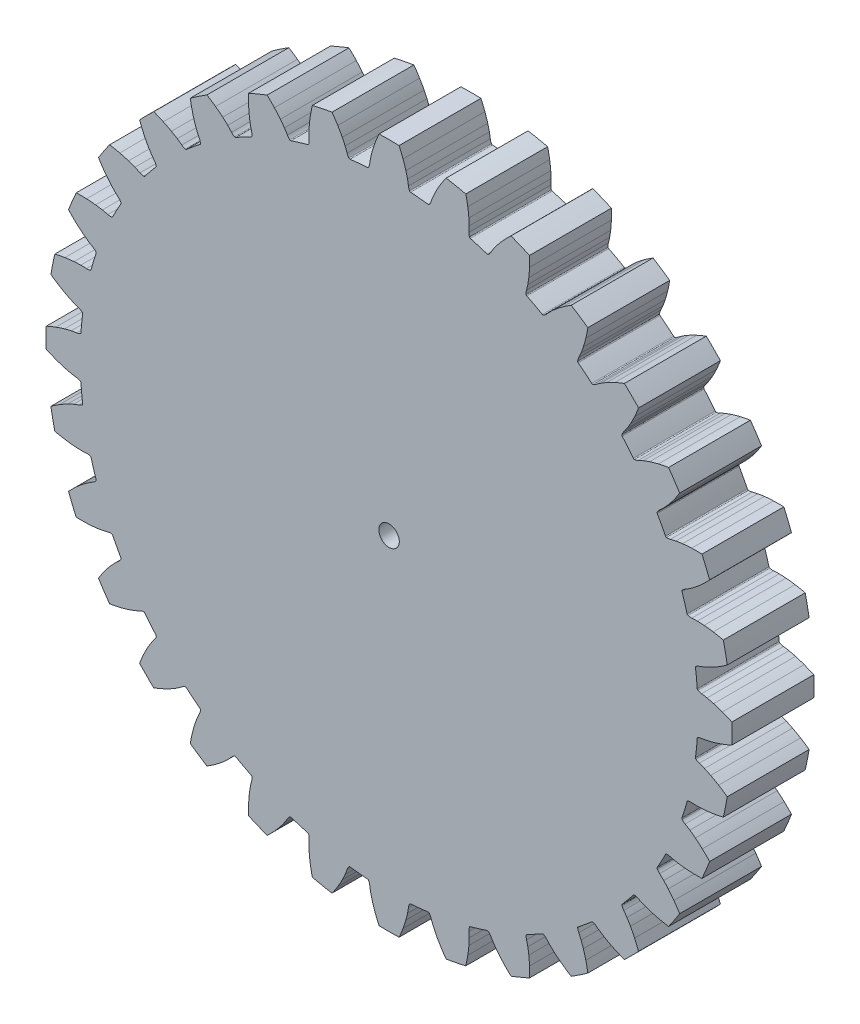
from build123d import *

# Parameters (mm, degrees)
BOSS_EXTRUDE1_DEPTH = 12.7
SKETCH2_R           = 1.5875
CUT_EXTRUDE1_DEPTH  = 77.306549185


with BuildPart() as part:
    # Model → Boss-Extrude1 (new body)
    with BuildSketch(Plane.XY):
        with BuildLine():
            ThreePointArc((47.688684308, -4.696925442), (47.750668499, -4.0181311), (47.802991315, -3.338523772))
            ThreePointArc((47.802991315, -3.338523772), (47.836540789, -3.240219855), (47.914385854, -3.171449418))
            ThreePointArc((47.914385854, -3.171449418), (48.187811806, -3.062492558), (48.475756522, -3.001491007))
            ThreePointArc((48.475756522, -3.001491007), (48.904401032, -2.939153054), (49.330070734, -2.858981734))
            ThreePointArc((49.330070734, -2.858981734), (49.842301009, -2.742156063), (50.350208962, -2.60777748))
            ThreePointArc((50.350208962, -2.60777748), (51.029288231, -2.400648092), (51.699447533, -2.166260071))
            ThreePointArc((51.699447533, -2.166260071), (52.446034926, -1.872790357), (53.181655372, -1.552821976))
            ThreePointArc((53.181655372, -1.552821976), (53.204320541, 0), (53.181655372, 1.552821976))
            ThreePointArc((53.181655372, 1.552821976), (52.446034933, 1.872790354), (51.699447549, 2.166260065))
            ThreePointArc((51.699447549, 2.166260065), (51.029288253, 2.400648085), (50.350208991, 2.607777472))
            ThreePointArc((50.350208991, 2.607777472), (49.84230104, 2.742156056), (49.330070766, 2.858981727))
            ThreePointArc((49.330070766, 2.858981727), (48.904401064, 2.939153049), (48.475756554, 3.001491003))
            ThreePointArc((48.475756554, 3.001491003), (48.187811841, 3.062492546), (47.914385887, 3.171449391))
            ThreePointArc((47.914385887, 3.171449391), (47.836540814, 3.24021982), (47.802991318, 3.338523731))
            ThreePointArc((47.802991318, 3.338523731), (47.68868431, 4.696925421), (47.535783919, 6.051525995))
            ThreePointArc((47.535783919, 6.051525995), (47.549510606, 6.154486207), (47.612443453, 6.237122059))
            ThreePointArc((47.612443453, 6.237122059), (47.859359173, 6.397328101), (48.1298703, 6.513332751))
            ThreePointArc((48.1298703, 6.513332751), (48.538116994, 6.658097293), (48.939966924, 6.819772183))
            ThreePointArc((48.939966924, 6.819772183), (49.419563281, 7.034284251), (49.891495964, 7.265168713))
            ThreePointArc((49.891495964, 7.265168713), (50.517117975, 7.600799961), (51.12867352, 7.961425877))
            ThreePointArc((51.12867352, 7.961425877), (51.803662344, 8.394908626), (52.462725316, 8.852241335))
            ThreePointArc((52.462725316, 8.852241335), (52.182014441, 10.379648027), (51.856844238, 11.898211209))
            ThreePointArc((51.856844238, 11.898211209), (51.072935805, 12.068519056), (50.283440788, 12.210697855))
            ThreePointArc((50.283440788, 12.210697855), (49.58043158, 12.309840583), (48.873991697, 12.380508245))
            ThreePointArc((48.873991697, 12.380508245), (48.349627093, 12.413216856), (47.824447623, 12.427866586))
            ThreePointArc((47.824447623, 12.427866586), (47.391316396, 12.423453399), (46.958746639, 12.400969151))
            ThreePointArc((46.958746639, 12.400969151), (46.664433891, 12.404623339), (46.375005314, 12.458143852))
            ThreePointArc((46.375005314, 12.458143852), (46.285239567, 12.510406057), (46.233156574, 12.600275903))
            ThreePointArc((46.233156574, 12.600275903), (45.856034921, 13.910276095), (45.441803005, 15.209019012))
            ThreePointArc((45.441803005, 15.209019012), (45.435179397, 15.312678816), (45.480781552, 15.406004433))
            ThreePointArc((45.480781552, 15.406004433), (45.691698208, 15.611303028), (45.934380154, 15.777852784))
            ThreePointArc((45.934380154, 15.777852784), (46.306540342, 15.999480695), (46.669127631, 16.236446079))
            ThreePointArc((46.669127631, 16.236446079), (47.09765945, 16.540400966), (47.515480755, 16.858918547))
            ThreePointArc((47.515480755, 16.858918547), (48.063603207, 17.310153534), (48.593053257, 17.783158692))
            ThreePointArc((48.593053257, 17.783158692), (49.170504071, 18.339995979), (49.727682147, 18.917117976))
            ThreePointArc((49.727682147, 18.917117976), (49.154382789, 20.360412001), (48.53920366, 21.786358858))
            ThreePointArc((48.53920366, 21.786358858), (47.737132396, 21.800461339), (46.935069596, 21.785885375))
            ThreePointArc((46.935069596, 21.785885375), (46.226226726, 21.74597281), (45.51957431, 21.677463029))
            ThreePointArc((45.51957431, 21.677463029), (44.998904092, 21.607244694), (44.480957778, 21.519155501))
            ThreePointArc((44.480957778, 21.519155501), (44.057010016, 21.430327401), (43.637138424, 21.323885009))
            ThreePointArc((43.637138424, 21.323885009), (43.347767917, 21.270051415), (43.053459295, 21.266078831))
            ThreePointArc((43.053459295, 21.266078831), (42.955222521, 21.299824404), (42.886607551, 21.377806538))
            ThreePointArc((42.886607551, 21.377806538), (42.261163825, 22.589062659), (41.601519086, 23.782037958))
            ThreePointArc((41.601519086, 23.782037958), (41.574799724, 23.882413766), (41.601318722, 23.982842696))
            ThreePointArc((41.601318722, 23.982842696), (41.768130904, 24.225344334), (41.97365754, 24.436038783))
            ThreePointArc((41.97365754, 24.436038783), (42.295429313, 24.726013026), (42.604819936, 25.029162458))
            ThreePointArc((42.604819936, 25.029162458), (42.965818979, 25.410879347), (43.313472268, 25.804789596))
            ThreePointArc((43.313472268, 25.804789596), (43.763031121, 26.354287614), (44.190029209, 26.921494692))
            ThreePointArc((44.190029209, 26.921494692), (44.647750902, 27.580287572), (45.081632041, 28.255020382))
            ThreePointArc((45.081632041, 28.255020382), (44.237775773, 29.558736761), (43.356228707, 30.837268954))
            ThreePointArc((43.356228707, 30.837268954), (42.566817759, 30.694624119), (41.783010001, 30.523853538))
            ThreePointArc((41.783010001, 30.523853538), (41.095573903, 30.346419498), (40.415865211, 30.141365065))
            ThreePointArc((40.415865211, 30.141365065), (39.918898443, 29.970918235), (39.42808967, 29.783475339))
            ThreePointArc((39.42808967, 29.783475339), (39.029617448, 29.613645941), (38.638579452, 29.427335925))
            ThreePointArc((38.638579452, 29.427335925), (38.365271531, 29.318083343), (38.07739298, 29.256770328))
            ThreePointArc((38.07739298, 29.256770328), (37.974460363, 29.270702445), (37.891950251, 29.333800058))
            ThreePointArc((37.891950251, 29.333800058), (37.042219904, 30.399764214), (36.162512118, 31.441126522))
            ThreePointArc((36.162512118, 31.441126522), (36.116723813, 31.534360948), (36.123140543, 31.638033764))
            ThreePointArc((36.123140543, 31.638033764), (36.239437753, 31.908419244), (36.399910804, 32.155161515))
            ThreePointArc((36.399910804, 32.155161515), (36.658928655, 32.502338544), (36.903232904, 32.860022161))
            ThreePointArc((36.903232904, 32.860022161), (37.182826181, 33.304831886), (37.446951331, 33.758997052))
            ThreePointArc((37.446951331, 33.758997052), (37.780670292, 34.385641202), (38.08880712, 35.025252749))
            ThreePointArc((38.08880712, 35.025252749), (38.409209704, 35.760684181), (38.703120097, 36.5070982))
            ThreePointArc((38.703120097, 36.5070982), (37.621135843, 37.621135843), (36.5070982, 38.703120097))
            ThreePointArc((36.5070982, 38.703120097), (35.760684189, 38.409209707), (35.025252764, 38.088807127))
            ThreePointArc((35.025252764, 38.088807127), (34.385641222, 37.780670303), (33.758997077, 37.446951346))
            ThreePointArc((33.758997077, 37.446951346), (33.304831913, 37.182826197), (32.860022188, 36.903232922))
            ThreePointArc((32.860022188, 36.903232922), (32.50233857, 36.658928674), (32.155161541, 36.399910824))
            ThreePointArc((32.155161541, 36.399910824), (31.908419277, 36.239437769), (31.638033806, 36.123140547))
            ThreePointArc((31.638033806, 36.123140547), (31.53436099, 36.116723805), (31.441126553, 36.162512091))
            ThreePointArc((31.441126553, 36.162512091), (30.399764246, 37.042219878), (29.33380009, 37.891950226))
            ThreePointArc((29.33380009, 37.891950226), (29.27070246, 37.974460324), (29.256770332, 38.077392938))
            ThreePointArc((29.256770332, 38.077392938), (29.318083333, 38.365271496), (29.427335911, 38.638579423))
            ThreePointArc((29.427335911, 38.638579423), (29.613645927, 39.029617418), (29.783475326, 39.42808964))
            ThreePointArc((29.783475326, 39.42808964), (29.970918225, 39.918898413), (30.141365056, 40.415865183))
            ThreePointArc((30.141365056, 40.415865183), (30.346419492, 41.095573881), (30.523853534, 41.783009985))
            ThreePointArc((30.523853534, 41.783009985), (30.694624117, 42.566817751), (30.837268954, 43.356228707))
            ThreePointArc((30.837268954, 43.356228707), (29.558736761, 44.237775773), (28.255020382, 45.081632041))
            ThreePointArc((28.255020382, 45.081632041), (27.580287579, 44.647750906), (26.921494706, 44.190029219))
            ThreePointArc((26.921494706, 44.190029219), (26.354287633, 43.763031136), (25.804789618, 43.313472287))
            ThreePointArc((25.804789618, 43.313472287), (25.41087937, 42.965819), (25.029162482, 42.604819959))
            ThreePointArc((25.029162482, 42.604819959), (24.726013049, 42.295429337), (24.436038804, 41.973657564))
            ThreePointArc((24.436038804, 41.973657564), (24.225344363, 41.768130926), (23.982842736, 41.601318734))
            ThreePointArc((23.982842736, 41.601318734), (23.882413809, 41.574799725), (23.782037994, 41.601519065))
            ThreePointArc((23.782037994, 41.601519065), (22.589062696, 42.261163806), (21.377806575, 42.886607533))
            ThreePointArc((21.377806575, 42.886607533), (21.299824427, 42.955222485), (21.266078844, 43.053459254))
            ThreePointArc((21.266078844, 43.053459254), (21.270051412, 43.34776788), (21.323885001, 43.637138393))
            ThreePointArc((21.323885001, 43.637138393), (21.430327394, 44.057009984), (21.519155495, 44.480957745))
            ThreePointArc((21.519155495, 44.480957745), (21.607244689, 44.998904061), (21.677463025, 45.519574281))
            ThreePointArc((21.677463025, 45.519574281), (21.745972809, 46.226226703), (21.785885375, 46.935069579))
            ThreePointArc((21.785885375, 46.935069579), (21.800461339, 47.737132387), (21.786358858, 48.53920366))
            ThreePointArc((21.786358858, 48.53920366), (20.360412001, 49.154382789), (18.917117976, 49.727682147))
            ThreePointArc((18.917117976, 49.727682147), (18.339995985, 49.170504077), (17.783158704, 48.59305327))
            ThreePointArc((17.783158704, 48.59305327), (17.310153549, 48.063603224), (16.858918565, 47.515480778))
            ThreePointArc((16.858918565, 47.515480778), (16.540400984, 47.097659475), (16.236446098, 46.669127659))
            ThreePointArc((16.236446098, 46.669127659), (15.999480712, 46.30654037), (15.7778528, 45.934380183))
            ThreePointArc((15.7778528, 45.934380183), (15.611303052, 45.691698235), (15.40600447, 45.480781572))
            ThreePointArc((15.40600447, 45.480781572), (15.312678858, 45.435179406), (15.209019052, 45.441802992))
            ThreePointArc((15.209019052, 45.441802992), (13.910276134, 45.856034909), (12.600275943, 46.233156564))
            ThreePointArc((12.600275943, 46.233156564), (12.510406086, 46.285239536), (12.458143872, 46.375005277))
            ThreePointArc((12.458143872, 46.375005277), (12.404623344, 46.664433855), (12.400969149, 46.958746606))
            ThreePointArc((12.400969149, 46.958746606), (12.423453398, 47.391316363), (12.427866586, 47.82444759))
            ThreePointArc((12.427866586, 47.82444759), (12.413216857, 48.349627062), (12.380508247, 48.873991667))
            ThreePointArc((12.380508247, 48.873991667), (12.309840586, 49.580431557), (12.210697858, 50.283440771))
            ThreePointArc((12.210697858, 50.283440771), (12.068519058, 51.072935797), (11.898211209, 51.856844238))
            ThreePointArc((11.898211209, 51.856844238), (10.379648027, 52.182014441), (8.852241335, 52.462725316))
            ThreePointArc((8.852241335, 52.462725316), (8.394908631, 51.803662352), (7.961425885, 51.128673535))
            ThreePointArc((7.961425885, 51.128673535), (7.600799972, 50.517117996), (7.265168727, 49.89149599))
            ThreePointArc((7.265168727, 49.89149599), (7.034284264, 49.419563309), (6.819772196, 48.939966954))
            ThreePointArc((6.819772196, 48.939966954), (6.658097305, 48.538117025), (6.513332761, 48.129870331))
            ThreePointArc((6.513332761, 48.129870331), (6.397328119, 47.859359205), (6.237122092, 47.61244348))
            ThreePointArc((6.237122092, 47.61244348), (6.154486246, 47.549510624), (6.051526036, 47.535783914))
            ThreePointArc((6.051526036, 47.535783914), (4.696925462, 47.688684306), (3.338523772, 47.802991315))
            ThreePointArc((3.338523772, 47.802991315), (3.240219855, 47.836540789), (3.171449418, 47.914385854))
            ThreePointArc((3.171449418, 47.914385854), (3.062492558, 48.187811806), (3.001491007, 48.475756522))
            ThreePointArc((3.001491007, 48.475756522), (2.939153054, 48.904401032), (2.858981734, 49.330070734))
            ThreePointArc((2.858981734, 49.330070734), (2.742156063, 49.842301009), (2.60777748, 50.350208962))
            ThreePointArc((2.60777748, 50.350208962), (2.400648092, 51.029288231), (2.166260071, 51.699447533))
            ThreePointArc((2.166260071, 51.699447533), (1.872790357, 52.446034926), (1.552821976, 53.181655372))
            ThreePointArc((1.552821976, 53.181655372), (0, 53.204320541), (-1.552821976, 53.181655372))
            ThreePointArc((-1.552821976, 53.181655372), (-1.872790354, 52.446034933), (-2.166260065, 51.699447549))
            ThreePointArc((-2.166260065, 51.699447549), (-2.400648085, 51.029288253), (-2.607777472, 50.350208991))
            ThreePointArc((-2.607777472, 50.350208991), (-2.742156056, 49.84230104), (-2.858981727, 49.330070766))
            ThreePointArc((-2.858981727, 49.330070766), (-2.939153049, 48.904401064), (-3.001491003, 48.475756554))
            ThreePointArc((-3.001491003, 48.475756554), (-3.062492546, 48.187811841), (-3.171449391, 47.914385887))
            ThreePointArc((-3.171449391, 47.914385887), (-3.24021982, 47.836540814), (-3.338523731, 47.802991318))
            ThreePointArc((-3.338523731, 47.802991318), (-4.696925421, 47.68868431), (-6.051525995, 47.535783919))
            ThreePointArc((-6.051525995, 47.535783919), (-6.154486207, 47.549510606), (-6.237122059, 47.612443453))
            ThreePointArc((-6.237122059, 47.612443453), (-6.397328101, 47.859359173), (-6.513332751, 48.1298703))
            ThreePointArc((-6.513332751, 48.1298703), (-6.658097293, 48.538116994), (-6.819772183, 48.939966924))
            ThreePointArc((-6.819772183, 48.939966924), (-7.034284251, 49.419563281), (-7.265168713, 49.891495964))
            ThreePointArc((-7.265168713, 49.891495964), (-7.600799961, 50.517117975), (-7.961425877, 51.12867352))
            ThreePointArc((-7.961425877, 51.12867352), (-8.394908626, 51.803662344), (-8.852241335, 52.462725316))
            ThreePointArc((-8.852241335, 52.462725316), (-10.379648027, 52.182014441), (-11.898211209, 51.856844238))
            ThreePointArc((-11.898211209, 51.856844238), (-12.068519056, 51.072935805), (-12.210697855, 50.283440788))
            ThreePointArc((-12.210697855, 50.283440788), (-12.309840583, 49.58043158), (-12.380508245, 48.873991697))
            ThreePointArc((-12.380508245, 48.873991697), (-12.413216856, 48.349627093), (-12.427866586, 47.824447623))
            ThreePointArc((-12.427866586, 47.824447623), (-12.423453399, 47.391316396), (-12.400969151, 46.958746639))
            ThreePointArc((-12.400969151, 46.958746639), (-12.404623339, 46.664433891), (-12.458143852, 46.375005314))
            ThreePointArc((-12.458143852, 46.375005314), (-12.510406057, 46.285239567), (-12.600275903, 46.233156574))
            ThreePointArc((-12.600275903, 46.233156574), (-13.910276095, 45.856034921), (-15.209019012, 45.441803005))
            ThreePointArc((-15.209019012, 45.441803005), (-15.312678816, 45.435179397), (-15.406004433, 45.480781552))
            ThreePointArc((-15.406004433, 45.480781552), (-15.611303028, 45.691698208), (-15.777852784, 45.934380154))
            ThreePointArc((-15.777852784, 45.934380154), (-15.999480695, 46.306540342), (-16.236446079, 46.669127631))
            ThreePointArc((-16.236446079, 46.669127631), (-16.540400966, 47.09765945), (-16.858918547, 47.515480755))
            ThreePointArc((-16.858918547, 47.515480755), (-17.310153534, 48.063603207), (-17.783158692, 48.593053257))
            ThreePointArc((-17.783158692, 48.593053257), (-18.339995979, 49.170504071), (-18.917117976, 49.727682147))
            ThreePointArc((-18.917117976, 49.727682147), (-20.360412001, 49.154382789), (-21.786358858, 48.53920366))
            ThreePointArc((-21.786358858, 48.53920366), (-21.800461339, 47.737132396), (-21.785885375, 46.935069596))
            ThreePointArc((-21.785885375, 46.935069596), (-21.74597281, 46.226226726), (-21.677463029, 45.51957431))
            ThreePointArc((-21.677463029, 45.51957431), (-21.607244694, 44.998904092), (-21.519155501, 44.480957778))
            ThreePointArc((-21.519155501, 44.480957778), (-21.430327401, 44.057010016), (-21.323885009, 43.637138424))
            ThreePointArc((-21.323885009, 43.637138424), (-21.270051415, 43.347767917), (-21.266078831, 43.053459295))
            ThreePointArc((-21.266078831, 43.053459295), (-21.299824404, 42.955222521), (-21.377806538, 42.886607551))
            ThreePointArc((-21.377806538, 42.886607551), (-22.589062659, 42.261163825), (-23.782037958, 41.601519086))
            ThreePointArc((-23.782037958, 41.601519086), (-23.882413766, 41.574799724), (-23.982842696, 41.601318722))
            ThreePointArc((-23.982842696, 41.601318722), (-24.225344334, 41.768130904), (-24.436038783, 41.97365754))
            ThreePointArc((-24.436038783, 41.97365754), (-24.726013026, 42.295429313), (-25.029162458, 42.604819936))
            ThreePointArc((-25.029162458, 42.604819936), (-25.410879347, 42.965818979), (-25.804789596, 43.313472268))
            ThreePointArc((-25.804789596, 43.313472268), (-26.354287614, 43.763031121), (-26.921494692, 44.190029209))
            ThreePointArc((-26.921494692, 44.190029209), (-27.580287572, 44.647750902), (-28.255020382, 45.081632041))
            ThreePointArc((-28.255020382, 45.081632041), (-29.558736761, 44.237775773), (-30.837268954, 43.356228707))
            ThreePointArc((-30.837268954, 43.356228707), (-30.694624119, 42.566817759), (-30.523853538, 41.783010001))
            ThreePointArc((-30.523853538, 41.783010001), (-30.346419498, 41.095573903), (-30.141365065, 40.415865211))
            ThreePointArc((-30.141365065, 40.415865211), (-29.970918235, 39.918898443), (-29.783475339, 39.42808967))
            ThreePointArc((-29.783475339, 39.42808967), (-29.613645941, 39.029617448), (-29.427335925, 38.638579452))
            ThreePointArc((-29.427335925, 38.638579452), (-29.318083343, 38.365271531), (-29.256770328, 38.07739298))
            ThreePointArc((-29.256770328, 38.07739298), (-29.270702445, 37.974460363), (-29.333800058, 37.891950251))
            ThreePointArc((-29.333800058, 37.891950251), (-30.399764214, 37.042219904), (-31.441126522, 36.162512118))
            ThreePointArc((-31.441126522, 36.162512118), (-31.534360948, 36.116723813), (-31.638033764, 36.123140543))
            ThreePointArc((-31.638033764, 36.123140543), (-31.908419244, 36.239437753), (-32.155161515, 36.399910804))
            ThreePointArc((-32.155161515, 36.399910804), (-32.502338544, 36.658928655), (-32.860022161, 36.903232904))
            ThreePointArc((-32.860022161, 36.903232904), (-33.304831886, 37.182826181), (-33.758997052, 37.446951331))
            ThreePointArc((-33.758997052, 37.446951331), (-34.385641202, 37.780670292), (-35.025252749, 38.08880712))
            ThreePointArc((-35.025252749, 38.08880712), (-35.760684181, 38.409209704), (-36.5070982, 38.703120097))
            ThreePointArc((-36.5070982, 38.703120097), (-37.621135843, 37.621135843), (-38.703120097, 36.5070982))
            ThreePointArc((-38.703120097, 36.5070982), (-38.409209707, 35.760684189), (-38.088807127, 35.025252764))
            ThreePointArc((-38.088807127, 35.025252764), (-37.780670303, 34.385641222), (-37.446951346, 33.758997077))
            ThreePointArc((-37.446951346, 33.758997077), (-37.182826197, 33.304831913), (-36.903232922, 32.860022188))
            ThreePointArc((-36.903232922, 32.860022188), (-36.658928674, 32.50233857), (-36.399910824, 32.155161541))
            ThreePointArc((-36.399910824, 32.155161541), (-36.239437769, 31.908419277), (-36.123140547, 31.638033806))
            ThreePointArc((-36.123140547, 31.638033806), (-36.116723805, 31.53436099), (-36.162512091, 31.441126553))
            ThreePointArc((-36.162512091, 31.441126553), (-37.042219878, 30.399764246), (-37.891950226, 29.33380009))
            ThreePointArc((-37.891950226, 29.33380009), (-37.974460324, 29.27070246), (-38.077392938, 29.256770332))
            ThreePointArc((-38.077392938, 29.256770332), (-38.365271496, 29.318083333), (-38.638579423, 29.427335911))
            ThreePointArc((-38.638579423, 29.427335911), (-39.029617418, 29.613645927), (-39.42808964, 29.783475326))
            ThreePointArc((-39.42808964, 29.783475326), (-39.918898413, 29.970918225), (-40.415865183, 30.141365056))
            ThreePointArc((-40.415865183, 30.141365056), (-41.095573881, 30.346419492), (-41.783009985, 30.523853534))
            ThreePointArc((-41.783009985, 30.523853534), (-42.566817751, 30.694624117), (-43.356228707, 30.837268954))
            ThreePointArc((-43.356228707, 30.837268954), (-44.237775773, 29.558736761), (-45.081632041, 28.255020382))
            ThreePointArc((-45.081632041, 28.255020382), (-44.647750906, 27.580287579), (-44.190029219, 26.921494706))
            ThreePointArc((-44.190029219, 26.921494706), (-43.763031136, 26.354287633), (-43.313472287, 25.804789618))
            ThreePointArc((-43.313472287, 25.804789618), (-42.965819, 25.41087937), (-42.604819959, 25.029162482))
            ThreePointArc((-42.604819959, 25.029162482), (-42.295429337, 24.726013049), (-41.973657564, 24.436038804))
            ThreePointArc((-41.973657564, 24.436038804), (-41.768130926, 24.225344363), (-41.601318734, 23.982842736))
            ThreePointArc((-41.601318734, 23.982842736), (-41.574799725, 23.882413809), (-41.601519065, 23.782037994))
            ThreePointArc((-41.601519065, 23.782037994), (-42.261163806, 22.589062696), (-42.886607533, 21.377806575))
            ThreePointArc((-42.886607533, 21.377806575), (-42.955222485, 21.299824427), (-43.053459254, 21.266078844))
            ThreePointArc((-43.053459254, 21.266078844), (-43.34776788, 21.270051412), (-43.637138393, 21.323885001))
            ThreePointArc((-43.637138393, 21.323885001), (-44.057009984, 21.430327394), (-44.480957745, 21.519155495))
            ThreePointArc((-44.480957745, 21.519155495), (-44.998904061, 21.607244689), (-45.519574281, 21.677463025))
            ThreePointArc((-45.519574281, 21.677463025), (-46.226226703, 21.745972809), (-46.935069579, 21.785885375))
            ThreePointArc((-46.935069579, 21.785885375), (-47.737132387, 21.800461339), (-48.53920366, 21.786358858))
            ThreePointArc((-48.53920366, 21.786358858), (-49.154382789, 20.360412001), (-49.727682147, 18.917117976))
            ThreePointArc((-49.727682147, 18.917117976), (-49.170504077, 18.339995985), (-48.59305327, 17.783158704))
            ThreePointArc((-48.59305327, 17.783158704), (-48.063603224, 17.310153549), (-47.515480778, 16.858918565))
            ThreePointArc((-47.515480778, 16.858918565), (-47.097659475, 16.540400984), (-46.669127659, 16.236446098))
            ThreePointArc((-46.669127659, 16.236446098), (-46.30654037, 15.999480712), (-45.934380183, 15.7778528))
            ThreePointArc((-45.934380183, 15.7778528), (-45.691698235, 15.611303052), (-45.480781572, 15.40600447))
            ThreePointArc((-45.480781572, 15.40600447), (-45.435179406, 15.312678858), (-45.441802992, 15.209019052))
            ThreePointArc((-45.441802992, 15.209019052), (-45.856034909, 13.910276134), (-46.233156564, 12.600275943))
            ThreePointArc((-46.233156564, 12.600275943), (-46.285239536, 12.510406086), (-46.375005277, 12.458143872))
            ThreePointArc((-46.375005277, 12.458143872), (-46.664433855, 12.404623344), (-46.958746606, 12.400969149))
            ThreePointArc((-46.958746606, 12.400969149), (-47.391316363, 12.423453398), (-47.82444759, 12.427866586))
            ThreePointArc((-47.82444759, 12.427866586), (-48.349627062, 12.413216857), (-48.873991667, 12.380508247))
            ThreePointArc((-48.873991667, 12.380508247), (-49.580431557, 12.309840586), (-50.283440771, 12.210697858))
            ThreePointArc((-50.283440771, 12.210697858), (-51.072935797, 12.068519058), (-51.856844238, 11.898211209))
            ThreePointArc((-51.856844238, 11.898211209), (-52.182014441, 10.379648027), (-52.462725316, 8.852241335))
            ThreePointArc((-52.462725316, 8.852241335), (-51.803662352, 8.394908631), (-51.128673535, 7.961425885))
            ThreePointArc((-51.128673535, 7.961425885), (-50.517117996, 7.600799972), (-49.89149599, 7.265168727))
            ThreePointArc((-49.89149599, 7.265168727), (-49.419563309, 7.034284264), (-48.939966954, 6.819772196))
            ThreePointArc((-48.939966954, 6.819772196), (-48.538117025, 6.658097305), (-48.129870331, 6.513332761))
            ThreePointArc((-48.129870331, 6.513332761), (-47.859359205, 6.397328119), (-47.61244348, 6.237122092))
            ThreePointArc((-47.61244348, 6.237122092), (-47.549510624, 6.154486246), (-47.535783914, 6.051526036))
            ThreePointArc((-47.535783914, 6.051526036), (-47.688684306, 4.696925462), (-47.802991315, 3.338523772))
            ThreePointArc((-47.802991315, 3.338523772), (-47.836540789, 3.240219855), (-47.914385854, 3.171449418))
            ThreePointArc((-47.914385854, 3.171449418), (-48.187811806, 3.062492558), (-48.475756522, 3.001491007))
            ThreePointArc((-48.475756522, 3.001491007), (-48.904401032, 2.939153054), (-49.330070734, 2.858981734))
            ThreePointArc((-49.330070734, 2.858981734), (-49.842301009, 2.742156063), (-50.350208962, 2.60777748))
            ThreePointArc((-50.350208962, 2.60777748), (-51.029288231, 2.400648092), (-51.699447533, 2.166260071))
            ThreePointArc((-51.699447533, 2.166260071), (-52.446034926, 1.872790357), (-53.181655372, 1.552821976))
            ThreePointArc((-53.181655372, 1.552821976), (-53.204320541, 0), (-53.181655372, -1.552821976))
            ThreePointArc((-53.181655372, -1.552821976), (-52.446034933, -1.872790354), (-51.699447549, -2.166260065))
            ThreePointArc((-51.699447549, -2.166260065), (-51.029288253, -2.400648085), (-50.350208991, -2.607777472))
            ThreePointArc((-50.350208991, -2.607777472), (-49.84230104, -2.742156056), (-49.330070766, -2.858981727))
            ThreePointArc((-49.330070766, -2.858981727), (-48.904401064, -2.939153049), (-48.475756554, -3.001491003))
            ThreePointArc((-48.475756554, -3.001491003), (-48.187811841, -3.062492546), (-47.914385887, -3.171449391))
            ThreePointArc((-47.914385887, -3.171449391), (-47.836540814, -3.24021982), (-47.802991318, -3.338523731))
            ThreePointArc((-47.802991318, -3.338523731), (-47.68868431, -4.696925421), (-47.535783919, -6.051525995))
            ThreePointArc((-47.535783919, -6.051525995), (-47.549510606, -6.154486207), (-47.612443453, -6.237122059))
            ThreePointArc((-47.612443453, -6.237122059), (-47.859359173, -6.397328101), (-48.1298703, -6.513332751))
            ThreePointArc((-48.1298703, -6.513332751), (-48.538116994, -6.658097293), (-48.939966924, -6.819772183))
            ThreePointArc((-48.939966924, -6.819772183), (-49.419563281, -7.034284251), (-49.891495964, -7.265168713))
            ThreePointArc((-49.891495964, -7.265168713), (-50.517117975, -7.600799961), (-51.12867352, -7.961425877))
            ThreePointArc((-51.12867352, -7.961425877), (-51.803662344, -8.394908626), (-52.462725316, -8.852241335))
            ThreePointArc((-52.462725316, -8.852241335), (-52.182014441, -10.379648027), (-51.856844238, -11.898211209))
            ThreePointArc((-51.856844238, -11.898211209), (-51.072935805, -12.068519056), (-50.283440788, -12.210697855))
            ThreePointArc((-50.283440788, -12.210697855), (-49.58043158, -12.309840583), (-48.873991697, -12.380508245))
            ThreePointArc((-48.873991697, -12.380508245), (-48.349627093, -12.413216856), (-47.824447623, -12.427866586))
            ThreePointArc((-47.824447623, -12.427866586), (-47.391316396, -12.423453399), (-46.958746639, -12.400969151))
            ThreePointArc((-46.958746639, -12.400969151), (-46.664433891, -12.404623339), (-46.375005314, -12.458143852))
            ThreePointArc((-46.375005314, -12.458143852), (-46.285239567, -12.510406057), (-46.233156574, -12.600275903))
            ThreePointArc((-46.233156574, -12.600275903), (-45.856034921, -13.910276095), (-45.441803005, -15.209019012))
            ThreePointArc((-45.441803005, -15.209019012), (-45.435179397, -15.312678816), (-45.480781552, -15.406004433))
            ThreePointArc((-45.480781552, -15.406004433), (-45.691698208, -15.611303028), (-45.934380154, -15.777852784))
            ThreePointArc((-45.934380154, -15.777852784), (-46.306540342, -15.999480695), (-46.669127631, -16.236446079))
            ThreePointArc((-46.669127631, -16.236446079), (-47.09765945, -16.540400966), (-47.515480755, -16.858918547))
            ThreePointArc((-47.515480755, -16.858918547), (-48.063603207, -17.310153534), (-48.593053257, -17.783158692))
            ThreePointArc((-48.593053257, -17.783158692), (-49.170504071, -18.339995979), (-49.727682147, -18.917117976))
            ThreePointArc((-49.727682147, -18.917117976), (-49.154382789, -20.360412001), (-48.53920366, -21.786358858))
            ThreePointArc((-48.53920366, -21.786358858), (-47.737132396, -21.800461339), (-46.935069596, -21.785885375))
            ThreePointArc((-46.935069596, -21.785885375), (-46.226226726, -21.74597281), (-45.51957431, -21.677463029))
            ThreePointArc((-45.51957431, -21.677463029), (-44.998904092, -21.607244694), (-44.480957778, -21.519155501))
            ThreePointArc((-44.480957778, -21.519155501), (-44.057010016, -21.430327401), (-43.637138424, -21.323885009))
            ThreePointArc((-43.637138424, -21.323885009), (-43.347767917, -21.270051415), (-43.053459295, -21.266078831))
            ThreePointArc((-43.053459295, -21.266078831), (-42.955222521, -21.299824404), (-42.886607551, -21.377806538))
            ThreePointArc((-42.886607551, -21.377806538), (-42.261163825, -22.589062659), (-41.601519086, -23.782037958))
            ThreePointArc((-41.601519086, -23.782037958), (-41.574799724, -23.882413766), (-41.601318722, -23.982842696))
            ThreePointArc((-41.601318722, -23.982842696), (-41.768130904, -24.225344334), (-41.97365754, -24.436038783))
            ThreePointArc((-41.97365754, -24.436038783), (-42.295429313, -24.726013026), (-42.604819936, -25.029162458))
            ThreePointArc((-42.604819936, -25.029162458), (-42.965818979, -25.410879347), (-43.313472268, -25.804789596))
            ThreePointArc((-43.313472268, -25.804789596), (-43.763031121, -26.354287614), (-44.190029209, -26.921494692))
            ThreePointArc((-44.190029209, -26.921494692), (-44.647750902, -27.580287572), (-45.081632041, -28.255020382))
            ThreePointArc((-45.081632041, -28.255020382), (-44.237775773, -29.558736761), (-43.356228707, -30.837268954))
            ThreePointArc((-43.356228707, -30.837268954), (-42.566817759, -30.694624119), (-41.783010001, -30.523853538))
            ThreePointArc((-41.783010001, -30.523853538), (-41.095573903, -30.346419498), (-40.415865211, -30.141365065))
            ThreePointArc((-40.415865211, -30.141365065), (-39.918898443, -29.970918235), (-39.42808967, -29.783475339))
            ThreePointArc((-39.42808967, -29.783475339), (-39.029617448, -29.613645941), (-38.638579452, -29.427335925))
            ThreePointArc((-38.638579452, -29.427335925), (-38.365271531, -29.318083343), (-38.07739298, -29.256770328))
            ThreePointArc((-38.07739298, -29.256770328), (-37.974460363, -29.270702445), (-37.891950251, -29.333800058))
            ThreePointArc((-37.891950251, -29.333800058), (-37.042219904, -30.399764214), (-36.162512118, -31.441126522))
            ThreePointArc((-36.162512118, -31.441126522), (-36.116723813, -31.534360948), (-36.123140543, -31.638033764))
            ThreePointArc((-36.123140543, -31.638033764), (-36.239437753, -31.908419244), (-36.399910804, -32.155161515))
            ThreePointArc((-36.399910804, -32.155161515), (-36.658928655, -32.502338544), (-36.903232904, -32.860022161))
            ThreePointArc((-36.903232904, -32.860022161), (-37.182826181, -33.304831886), (-37.446951331, -33.758997052))
            ThreePointArc((-37.446951331, -33.758997052), (-37.780670292, -34.385641202), (-38.08880712, -35.025252749))
            ThreePointArc((-38.08880712, -35.025252749), (-38.409209704, -35.760684181), (-38.703120097, -36.5070982))
            ThreePointArc((-38.703120097, -36.5070982), (-37.621135843, -37.621135843), (-36.5070982, -38.703120097))
            ThreePointArc((-36.5070982, -38.703120097), (-35.760684189, -38.409209707), (-35.025252764, -38.088807127))
            ThreePointArc((-35.025252764, -38.088807127), (-34.385641222, -37.780670303), (-33.758997077, -37.446951346))
            ThreePointArc((-33.758997077, -37.446951346), (-33.304831913, -37.182826197), (-32.860022188, -36.903232922))
            ThreePointArc((-32.860022188, -36.903232922), (-32.50233857, -36.658928674), (-32.155161541, -36.399910824))
            ThreePointArc((-32.155161541, -36.399910824), (-31.908419277, -36.239437769), (-31.638033806, -36.123140547))
            ThreePointArc((-31.638033806, -36.123140547), (-31.53436099, -36.116723805), (-31.441126553, -36.162512091))
            ThreePointArc((-31.441126553, -36.162512091), (-30.399764246, -37.042219878), (-29.33380009, -37.891950226))
            ThreePointArc((-29.33380009, -37.891950226), (-29.27070246, -37.974460324), (-29.256770332, -38.077392938))
            ThreePointArc((-29.256770332, -38.077392938), (-29.318083333, -38.365271496), (-29.427335911, -38.638579423))
            ThreePointArc((-29.427335911, -38.638579423), (-29.613645927, -39.029617418), (-29.783475326, -39.42808964))
            ThreePointArc((-29.783475326, -39.42808964), (-29.970918225, -39.918898413), (-30.141365056, -40.415865183))
            ThreePointArc((-30.141365056, -40.415865183), (-30.346419492, -41.095573881), (-30.523853534, -41.783009985))
            ThreePointArc((-30.523853534, -41.783009985), (-30.694624117, -42.566817751), (-30.837268954, -43.356228707))
            ThreePointArc((-30.837268954, -43.356228707), (-29.558736761, -44.237775773), (-28.255020382, -45.081632041))
            ThreePointArc((-28.255020382, -45.081632041), (-27.580287579, -44.647750906), (-26.921494706, -44.190029219))
            ThreePointArc((-26.921494706, -44.190029219), (-26.354287633, -43.763031136), (-25.804789618, -43.313472287))
            ThreePointArc((-25.804789618, -43.313472287), (-25.41087937, -42.965819), (-25.029162482, -42.604819959))
            ThreePointArc((-25.029162482, -42.604819959), (-24.726013049, -42.295429337), (-24.436038804, -41.973657564))
            ThreePointArc((-24.436038804, -41.973657564), (-24.225344363, -41.768130926), (-23.982842736, -41.601318734))
            ThreePointArc((-23.982842736, -41.601318734), (-23.882413809, -41.574799725), (-23.782037994, -41.601519065))
            ThreePointArc((-23.782037994, -41.601519065), (-22.589062696, -42.261163806), (-21.377806575, -42.886607533))
            ThreePointArc((-21.377806575, -42.886607533), (-21.299824427, -42.955222485), (-21.266078844, -43.053459254))
            ThreePointArc((-21.266078844, -43.053459254), (-21.270051412, -43.34776788), (-21.323885001, -43.637138393))
            ThreePointArc((-21.323885001, -43.637138393), (-21.430327394, -44.057009984), (-21.519155495, -44.480957745))
            ThreePointArc((-21.519155495, -44.480957745), (-21.607244689, -44.998904061), (-21.677463025, -45.519574281))
            ThreePointArc((-21.677463025, -45.519574281), (-21.745972809, -46.226226703), (-21.785885375, -46.935069579))
            ThreePointArc((-21.785885375, -46.935069579), (-21.800461339, -47.737132387), (-21.786358858, -48.53920366))
            ThreePointArc((-21.786358858, -48.53920366), (-20.360412001, -49.154382789), (-18.917117976, -49.727682147))
            ThreePointArc((-18.917117976, -49.727682147), (-18.339995985, -49.170504077), (-17.783158704, -48.59305327))
            ThreePointArc((-17.783158704, -48.59305327), (-17.310153549, -48.063603224), (-16.858918565, -47.515480778))
            ThreePointArc((-16.858918565, -47.515480778), (-16.540400984, -47.097659475), (-16.236446098, -46.669127659))
            ThreePointArc((-16.236446098, -46.669127659), (-15.999480712, -46.30654037), (-15.7778528, -45.934380183))
            ThreePointArc((-15.7778528, -45.934380183), (-15.611303052, -45.691698235), (-15.40600447, -45.480781572))
            ThreePointArc((-15.40600447, -45.480781572), (-15.312678858, -45.435179406), (-15.209019052, -45.441802992))
            ThreePointArc((-15.209019052, -45.441802992), (-13.910276134, -45.856034909), (-12.600275943, -46.233156564))
            ThreePointArc((-12.600275943, -46.233156564), (-12.510406086, -46.285239536), (-12.458143872, -46.375005277))
            ThreePointArc((-12.458143872, -46.375005277), (-12.404623344, -46.664433855), (-12.400969149, -46.958746606))
            ThreePointArc((-12.400969149, -46.958746606), (-12.423453398, -47.391316363), (-12.427866586, -47.82444759))
            ThreePointArc((-12.427866586, -47.82444759), (-12.413216857, -48.349627062), (-12.380508247, -48.873991667))
            ThreePointArc((-12.380508247, -48.873991667), (-12.309840586, -49.580431557), (-12.210697858, -50.283440771))
            ThreePointArc((-12.210697858, -50.283440771), (-12.068519058, -51.072935797), (-11.898211209, -51.856844238))
            ThreePointArc((-11.898211209, -51.856844238), (-10.379648027, -52.182014441), (-8.852241335, -52.462725316))
            ThreePointArc((-8.852241335, -52.462725316), (-8.394908631, -51.803662352), (-7.961425885, -51.128673535))
            ThreePointArc((-7.961425885, -51.128673535), (-7.600799972, -50.517117996), (-7.265168727, -49.89149599))
            ThreePointArc((-7.265168727, -49.89149599), (-7.034284264, -49.419563309), (-6.819772196, -48.939966954))
            ThreePointArc((-6.819772196, -48.939966954), (-6.658097305, -48.538117025), (-6.513332761, -48.129870331))
            ThreePointArc((-6.513332761, -48.129870331), (-6.397328119, -47.859359205), (-6.237122092, -47.61244348))
            ThreePointArc((-6.237122092, -47.61244348), (-6.154486246, -47.549510624), (-6.051526036, -47.535783914))
            ThreePointArc((-6.051526036, -47.535783914), (-4.696925462, -47.688684306), (-3.338523772, -47.802991315))
            ThreePointArc((-3.338523772, -47.802991315), (-3.240219855, -47.836540789), (-3.171449418, -47.914385854))
            ThreePointArc((-3.171449418, -47.914385854), (-3.062492558, -48.187811806), (-3.001491007, -48.475756522))
            ThreePointArc((-3.001491007, -48.475756522), (-2.939153054, -48.904401032), (-2.858981734, -49.330070734))
            ThreePointArc((-2.858981734, -49.330070734), (-2.742156063, -49.842301009), (-2.60777748, -50.350208962))
            ThreePointArc((-2.60777748, -50.350208962), (-2.400648092, -51.029288231), (-2.166260071, -51.699447533))
            ThreePointArc((-2.166260071, -51.699447533), (-1.872790357, -52.446034926), (-1.552821976, -53.181655372))
            ThreePointArc((-1.552821976, -53.181655372), (0, -53.204320541), (1.552821976, -53.181655372))
            ThreePointArc((1.552821976, -53.181655372), (1.872790354, -52.446034933), (2.166260065, -51.699447549))
            ThreePointArc((2.166260065, -51.699447549), (2.400648085, -51.029288253), (2.607777472, -50.350208991))
            ThreePointArc((2.607777472, -50.350208991), (2.742156056, -49.84230104), (2.858981727, -49.330070766))
            ThreePointArc((2.858981727, -49.330070766), (2.939153049, -48.904401064), (3.001491003, -48.475756554))
            ThreePointArc((3.001491003, -48.475756554), (3.062492546, -48.187811841), (3.171449391, -47.914385887))
            ThreePointArc((3.171449391, -47.914385887), (3.24021982, -47.836540814), (3.338523731, -47.802991318))
            ThreePointArc((3.338523731, -47.802991318), (4.696925421, -47.68868431), (6.051525995, -47.535783919))
            ThreePointArc((6.051525995, -47.535783919), (6.154486207, -47.549510606), (6.237122059, -47.612443453))
            ThreePointArc((6.237122059, -47.612443453), (6.397328101, -47.859359173), (6.513332751, -48.1298703))
            ThreePointArc((6.513332751, -48.1298703), (6.658097293, -48.538116994), (6.819772183, -48.939966924))
            ThreePointArc((6.819772183, -48.939966924), (7.034284251, -49.419563281), (7.265168713, -49.891495964))
            ThreePointArc((7.265168713, -49.891495964), (7.600799961, -50.517117975), (7.961425877, -51.12867352))
            ThreePointArc((7.961425877, -51.12867352), (8.394908626, -51.803662344), (8.852241335, -52.462725316))
            ThreePointArc((8.852241335, -52.462725316), (10.379648027, -52.182014441), (11.898211209, -51.856844238))
            ThreePointArc((11.898211209, -51.856844238), (12.068519056, -51.072935805), (12.210697855, -50.283440788))
            ThreePointArc((12.210697855, -50.283440788), (12.309840583, -49.58043158), (12.380508245, -48.873991697))
            ThreePointArc((12.380508245, -48.873991697), (12.413216856, -48.349627093), (12.427866586, -47.824447623))
            ThreePointArc((12.427866586, -47.824447623), (12.423453399, -47.391316396), (12.400969151, -46.958746639))
            ThreePointArc((12.400969151, -46.958746639), (12.404623339, -46.664433891), (12.458143852, -46.375005314))
            ThreePointArc((12.458143852, -46.375005314), (12.510406057, -46.285239567), (12.600275903, -46.233156574))
            ThreePointArc((12.600275903, -46.233156574), (13.910276095, -45.856034921), (15.209019012, -45.441803005))
            ThreePointArc((15.209019012, -45.441803005), (15.312678816, -45.435179397), (15.406004433, -45.480781552))
            ThreePointArc((15.406004433, -45.480781552), (15.611303028, -45.691698208), (15.777852784, -45.934380154))
            ThreePointArc((15.777852784, -45.934380154), (15.999480695, -46.306540342), (16.236446079, -46.669127631))
            ThreePointArc((16.236446079, -46.669127631), (16.540400966, -47.09765945), (16.858918547, -47.515480755))
            ThreePointArc((16.858918547, -47.515480755), (17.310153534, -48.063603207), (17.783158692, -48.593053257))
            ThreePointArc((17.783158692, -48.593053257), (18.339995979, -49.170504071), (18.917117976, -49.727682147))
            ThreePointArc((18.917117976, -49.727682147), (20.360412001, -49.154382789), (21.786358858, -48.53920366))
            ThreePointArc((21.786358858, -48.53920366), (21.800461339, -47.737132396), (21.785885375, -46.935069596))
            ThreePointArc((21.785885375, -46.935069596), (21.74597281, -46.226226726), (21.677463029, -45.51957431))
            ThreePointArc((21.677463029, -45.51957431), (21.607244694, -44.998904092), (21.519155501, -44.480957778))
            ThreePointArc((21.519155501, -44.480957778), (21.430327401, -44.057010016), (21.323885009, -43.637138424))
            ThreePointArc((21.323885009, -43.637138424), (21.270051415, -43.347767917), (21.266078831, -43.053459295))
            ThreePointArc((21.266078831, -43.053459295), (21.299824404, -42.955222521), (21.377806538, -42.886607551))
            ThreePointArc((21.377806538, -42.886607551), (22.589062659, -42.261163825), (23.782037958, -41.601519086))
            ThreePointArc((23.782037958, -41.601519086), (23.882413766, -41.574799724), (23.982842696, -41.601318722))
            ThreePointArc((23.982842696, -41.601318722), (24.225344334, -41.768130904), (24.436038783, -41.97365754))
            ThreePointArc((24.436038783, -41.97365754), (24.726013026, -42.295429313), (25.029162458, -42.604819936))
            ThreePointArc((25.029162458, -42.604819936), (25.410879347, -42.965818979), (25.804789596, -43.313472268))
            ThreePointArc((25.804789596, -43.313472268), (26.354287614, -43.763031121), (26.921494692, -44.190029209))
            ThreePointArc((26.921494692, -44.190029209), (27.580287572, -44.647750902), (28.255020382, -45.081632041))
            ThreePointArc((28.255020382, -45.081632041), (29.558736761, -44.237775773), (30.837268954, -43.356228707))
            ThreePointArc((30.837268954, -43.356228707), (30.694624119, -42.566817759), (30.523853538, -41.783010001))
            ThreePointArc((30.523853538, -41.783010001), (30.346419498, -41.095573903), (30.141365065, -40.415865211))
            ThreePointArc((30.141365065, -40.415865211), (29.970918235, -39.918898443), (29.783475339, -39.42808967))
            ThreePointArc((29.783475339, -39.42808967), (29.613645941, -39.029617448), (29.427335925, -38.638579452))
            ThreePointArc((29.427335925, -38.638579452), (29.318083343, -38.365271531), (29.256770328, -38.07739298))
            ThreePointArc((29.256770328, -38.07739298), (29.270702445, -37.974460363), (29.333800058, -37.891950251))
            ThreePointArc((29.333800058, -37.891950251), (30.399764214, -37.042219904), (31.441126522, -36.162512118))
            ThreePointArc((31.441126522, -36.162512118), (31.534360948, -36.116723813), (31.638033764, -36.123140543))
            ThreePointArc((31.638033764, -36.123140543), (31.908419244, -36.239437753), (32.155161515, -36.399910804))
            ThreePointArc((32.155161515, -36.399910804), (32.502338544, -36.658928655), (32.860022161, -36.903232904))
            ThreePointArc((32.860022161, -36.903232904), (33.304831886, -37.182826181), (33.758997052, -37.446951331))
            ThreePointArc((33.758997052, -37.446951331), (34.385641202, -37.780670292), (35.025252749, -38.08880712))
            ThreePointArc((35.025252749, -38.08880712), (35.760684181, -38.409209704), (36.5070982, -38.703120097))
            ThreePointArc((36.5070982, -38.703120097), (37.621135843, -37.621135843), (38.703120097, -36.5070982))
            ThreePointArc((38.703120097, -36.5070982), (38.409209707, -35.760684189), (38.088807127, -35.025252764))
            ThreePointArc((38.088807127, -35.025252764), (37.780670303, -34.385641222), (37.446951346, -33.758997077))
            ThreePointArc((37.446951346, -33.758997077), (37.182826197, -33.304831913), (36.903232922, -32.860022188))
            ThreePointArc((36.903232922, -32.860022188), (36.658928674, -32.50233857), (36.399910824, -32.155161541))
            ThreePointArc((36.399910824, -32.155161541), (36.239437769, -31.908419277), (36.123140547, -31.638033806))
            ThreePointArc((36.123140547, -31.638033806), (36.116723805, -31.53436099), (36.162512091, -31.441126553))
            ThreePointArc((36.162512091, -31.441126553), (37.042219878, -30.399764246), (37.891950226, -29.33380009))
            ThreePointArc((37.891950226, -29.33380009), (37.974460324, -29.27070246), (38.077392938, -29.256770332))
            ThreePointArc((38.077392938, -29.256770332), (38.365271496, -29.318083333), (38.638579423, -29.427335911))
            ThreePointArc((38.638579423, -29.427335911), (39.029617418, -29.613645927), (39.42808964, -29.783475326))
            ThreePointArc((39.42808964, -29.783475326), (39.918898413, -29.970918225), (40.415865183, -30.141365056))
            ThreePointArc((40.415865183, -30.141365056), (41.095573881, -30.346419492), (41.783009985, -30.523853534))
            ThreePointArc((41.783009985, -30.523853534), (42.566817751, -30.694624117), (43.356228707, -30.837268954))
            ThreePointArc((43.356228707, -30.837268954), (44.237775773, -29.558736761), (45.081632041, -28.255020382))
            ThreePointArc((45.081632041, -28.255020382), (44.647750906, -27.580287579), (44.190029219, -26.921494706))
            ThreePointArc((44.190029219, -26.921494706), (43.763031136, -26.354287633), (43.313472287, -25.804789618))
            ThreePointArc((43.313472287, -25.804789618), (42.965819, -25.41087937), (42.604819959, -25.029162482))
            ThreePointArc((42.604819959, -25.029162482), (42.295429337, -24.726013049), (41.973657564, -24.436038804))
            ThreePointArc((41.973657564, -24.436038804), (41.768130926, -24.225344363), (41.601318734, -23.982842736))
            ThreePointArc((41.601318734, -23.982842736), (41.574799725, -23.882413809), (41.601519065, -23.782037994))
            ThreePointArc((41.601519065, -23.782037994), (42.261163806, -22.589062696), (42.886607533, -21.377806575))
            ThreePointArc((42.886607533, -21.377806575), (42.955222485, -21.299824427), (43.053459254, -21.266078844))
            ThreePointArc((43.053459254, -21.266078844), (43.34776788, -21.270051412), (43.637138393, -21.323885001))
            ThreePointArc((43.637138393, -21.323885001), (44.057009984, -21.430327394), (44.480957745, -21.519155495))
            ThreePointArc((44.480957745, -21.519155495), (44.998904061, -21.607244689), (45.519574281, -21.677463025))
            ThreePointArc((45.519574281, -21.677463025), (46.226226703, -21.745972809), (46.935069579, -21.785885375))
            ThreePointArc((46.935069579, -21.785885375), (47.737132387, -21.800461339), (48.53920366, -21.786358858))
            ThreePointArc((48.53920366, -21.786358858), (49.154382789, -20.360412001), (49.727682147, -18.917117976))
            ThreePointArc((49.727682147, -18.917117976), (49.170504077, -18.339995985), (48.59305327, -17.783158704))
            ThreePointArc((48.59305327, -17.783158704), (48.063603224, -17.310153549), (47.515480778, -16.858918565))
            ThreePointArc((47.515480778, -16.858918565), (47.097659475, -16.540400984), (46.669127659, -16.236446098))
            ThreePointArc((46.669127659, -16.236446098), (46.30654037, -15.999480712), (45.934380183, -15.7778528))
            ThreePointArc((45.934380183, -15.7778528), (45.691698235, -15.611303052), (45.480781572, -15.40600447))
            ThreePointArc((45.480781572, -15.40600447), (45.435179406, -15.312678858), (45.441802992, -15.209019052))
            ThreePointArc((45.441802992, -15.209019052), (45.856034909, -13.910276134), (46.233156564, -12.600275943))
            ThreePointArc((46.233156564, -12.600275943), (46.285239536, -12.510406086), (46.375005277, -12.458143872))
            ThreePointArc((46.375005277, -12.458143872), (46.664433855, -12.404623344), (46.958746606, -12.400969149))
            ThreePointArc((46.958746606, -12.400969149), (47.391316363, -12.423453398), (47.82444759, -12.427866586))
            ThreePointArc((47.82444759, -12.427866586), (48.349627062, -12.413216857), (48.873991667, -12.380508247))
            ThreePointArc((48.873991667, -12.380508247), (49.580431557, -12.309840586), (50.283440771, -12.210697858))
            ThreePointArc((50.283440771, -12.210697858), (51.072935797, -12.068519058), (51.856844238, -11.898211209))
            ThreePointArc((51.856844238, -11.898211209), (52.182014441, -10.379648027), (52.462725316, -8.852241335))
            ThreePointArc((52.462725316, -8.852241335), (51.803662352, -8.394908631), (51.128673535, -7.961425885))
            ThreePointArc((51.128673535, -7.961425885), (50.517117996, -7.600799972), (49.89149599, -7.265168727))
            ThreePointArc((49.89149599, -7.265168727), (49.419563309, -7.034284264), (48.939966954, -6.819772196))
            ThreePointArc((48.939966954, -6.819772196), (48.538117025, -6.658097305), (48.129870331, -6.513332761))
            ThreePointArc((48.129870331, -6.513332761), (47.859359205, -6.397328119), (47.61244348, -6.237122092))
            ThreePointArc((47.61244348, -6.237122092), (47.549510624, -6.154486246), (47.535783914, -6.051526036))
            ThreePointArc((47.535783914, -6.051526036), (47.617051281, -5.374769477), (47.688684308, -4.696925442))
        make_face()
    extrude(amount=BOSS_EXTRUDE1_DEPTH)

    # Sketch2 → Cut-Extrude1 (cut, through all)
    with BuildSketch(Plane.XY.offset(12.7)):
        Circle(SKETCH2_R)
    extrude(amount=-CUT_EXTRUDE1_DEPTH, mode=Mode.SUBTRACT)


solid = part.part
